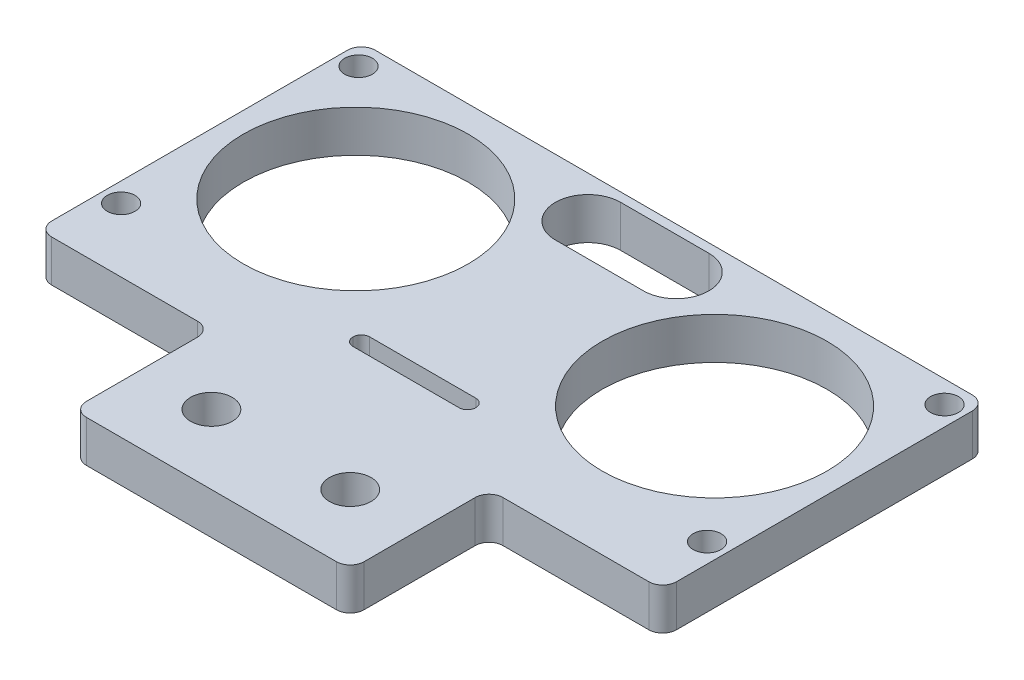
from build123d import *

# Parameters (mm, degrees)
SKETCH1_R           = 1
SKETCH1_R_2         = 8.1
SKETCH1_R_3         = 1.5
BOSS_EXTRUDE1_DEPTH = 3
SKETCH2_W           = 8.84
SKETCH2_H           = 1.2
CUT_EXTRUDE1_DEPTH  = 3
FILLET1_R           = 1
FILLET4_R           = 0.6


with BuildPart() as part:
    # Sketch1 → Boss-Extrude1 (new body)
    with BuildSketch(Plane(origin=(0, 0, 0), x_dir=(1, 0, 0), z_dir=(0, 1, 0))):
        Polygon((0, 0), (0, 20.3), (45, 20.3), (45, 0), (45, -3), (32.5, -3), (32.5, -13), (12.5, -13), (12.5, -3), (0, -3), align=None)
        with Locations(Location((1.4, 18.7, 0), (0, 0, 270))):
            Circle(SKETCH1_R, mode=Mode.SUBTRACT)
        with Locations(Location((1.4, 1.6, 0), (0, 0, 90))):
            Circle(SKETCH1_R, mode=Mode.SUBTRACT)
        with Locations(Location((43.6, 1.6, 0), (0, 0, 270))):
            Circle(SKETCH1_R, mode=Mode.SUBTRACT)
        with Locations(Location((43.6, 18.7, 0), (0, 0, 90))):
            Circle(SKETCH1_R, mode=Mode.SUBTRACT)
        with Locations(Location((9.58, 10.32, 0), (0, 0, 270))):
            Circle(SKETCH1_R_2, mode=Mode.SUBTRACT)
        with Locations(Location((35.42, 10.32, 0), (0, 0, 270))):
            Circle(SKETCH1_R_2, mode=Mode.SUBTRACT)
        with Locations(Location((17.5, -8, 0), (0, 0, 270))):
            Circle(SKETCH1_R_3, mode=Mode.SUBTRACT)
        with Locations(Location((27.5, -8, 0), (0, 0, 270))):
            Circle(SKETCH1_R_3, mode=Mode.SUBTRACT)
        with BuildLine():
            Line((25.675, 19.65), (19.325, 19.65))
            ThreePointArc((19.325, 19.65), (16.975, 17.3), (19.325, 14.95))
            Line((19.325, 14.95), (25.675, 14.95))
            ThreePointArc((25.675, 14.95), (28.025, 17.3), (25.675, 19.65))
        make_face(mode=Mode.SUBTRACT)
    extrude(amount=BOSS_EXTRUDE1_DEPTH)

    # Sketch2 → Cut-Extrude1 (cut)
    with BuildSketch(Plane(origin=(0, 3, 0), x_dir=(1, 0, 0), z_dir=(0, 1, 0))):
        with Locations((22.5, 1.62)):
            Rectangle(SKETCH2_W, SKETCH2_H)
    extrude(amount=-CUT_EXTRUDE1_DEPTH, mode=Mode.SUBTRACT)

    # Fillet1
    fillet1_edges = [part.edges().sort_by_distance(p)[0] for p in [
        (0, 1.5, -20.3),
        (45, 1.5, -20.3),
        (45, 1.5, 3),
        (32.5, 1.5, 3),
        (32.5, 1.5, 13),
        (12.5, 1.5, 13),
        (12.5, 1.5, 3),
        (0, 1.5, 3),
    ]]
    fillet(fillet1_edges, radius=FILLET1_R)

    # Fillet4
    fillet4_edges = [part.edges().sort_by_distance(p)[0] for p in [
        (26.92, 1.5, -2.22),
        (26.92, 1.5, -1.02),
        (18.08, 1.5, -1.02),
        (18.08, 1.5, -2.22),
    ]]
    fillet(fillet4_edges, radius=FILLET4_R - 0.0001)  # a hair under: the kernel refuses the full size


solid = part.part
